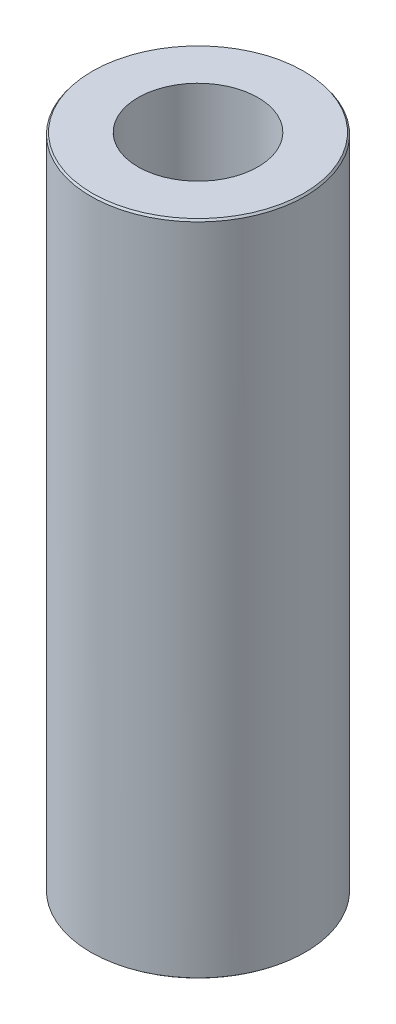
from build123d import *
from OCP.BRepFilletAPI import BRepFilletAPI_MakeChamfer

# Parameters (mm, degrees)
SKETCH1_R           = 47.5
BOSS_EXTRUDE1_DEPTH = 291.530436426
SKETCH2_R           = 26.588189359
CUT_EXTRUDE1_DEPTH  = 300.169676542
CHAMFER1_SIZE       = 0.838906616
CHAMFER1_SIZE2      = 0.656438448


with BuildPart() as part:
    # Sketch1 → Boss-Extrude1 (new body)
    with BuildSketch(Plane(origin=(0, 0, 0), x_dir=(1, 0, 0), z_dir=(0, 1, 0))):
        Circle(SKETCH1_R)
    extrude(amount=BOSS_EXTRUDE1_DEPTH)

    # Sketch2 → Cut-Extrude1 (cut, through all)
    with BuildSketch(Plane(origin=(0, 0, 0), x_dir=(1, 0, 0), z_dir=(0, 1, 0))):
        Circle(SKETCH2_R)
    extrude(amount=CUT_EXTRUDE1_DEPTH, mode=Mode.SUBTRACT)

    # Chamfer1: one chamfer whose edges measure the first distance from different faces: ONE call of the kernel's chamfer builder (chamfer() names one face for all edges)
    chamfer1_edges_1 = [part.edges().sort_by_distance(p)[0] for p in [
        (-47.5, 291.530436426, 0),
    ]]
    chamfer1_side_1 = [part.faces().sort_by_distance(p)[0] for p in [
        (-47.5, 145.765218213, 0),
    ]]
    chamfer1_edges_2 = [part.edges().sort_by_distance(p)[0] for p in [
        (-47.5, 0, 0),
    ]]
    chamfer1_side_2 = [part.faces().sort_by_distance(p)[0] for p in [
        (-46.156497116, 0, 0),
    ]]
    chamfer1 = BRepFilletAPI_MakeChamfer(part.part.solid().wrapped)
    for e in chamfer1_edges_1:
        chamfer1.Add(CHAMFER1_SIZE, CHAMFER1_SIZE2, e.wrapped, chamfer1_side_1[0].wrapped)  # the first distance lies on this face
    for e in chamfer1_edges_2:
        chamfer1.Add(CHAMFER1_SIZE, CHAMFER1_SIZE2, e.wrapped, chamfer1_side_2[0].wrapped)  # the first distance lies on this face
    add(Compound.cast(chamfer1.Shape()), mode=Mode.REPLACE)


solid = part.part
